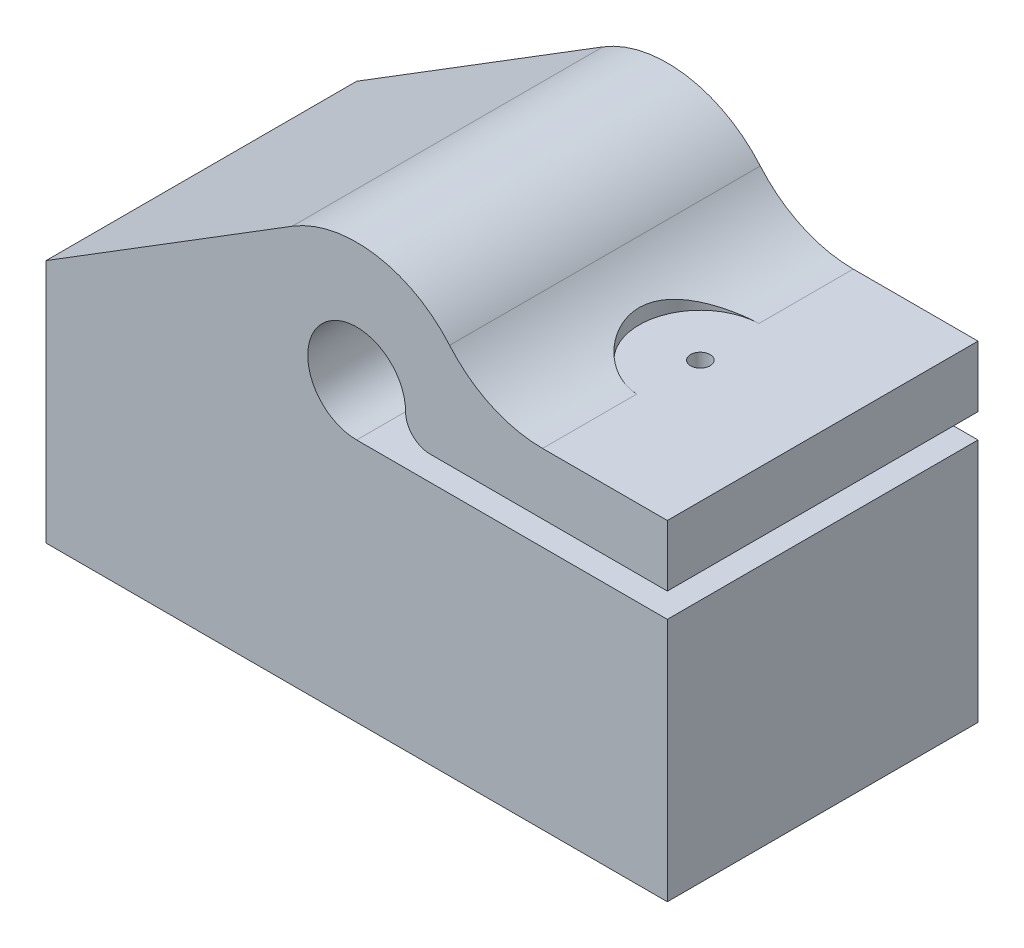
from build123d import *

# Parameters (mm, degrees)
SKETCH1_W                   = 50.8
SKETCH1_H                   = 25.4
BOSS_EXTRUDE1_DEPTH         = 20
BOSS_EXTRUDE2_DEPTH         = 25.4
FILLET1_R                   = 10
FILLET2_R                   = 2
SKETCH3_R                   = 5
CUT_EXTRUDE1_DEPTH          = 40.184818489
TAP_DRILL_FOR_M2X0_4_TAP1_D = 1.6


with BuildPart() as part:
    # Sketch1 → Boss-Extrude1 (new body)
    with BuildSketch(Plane(origin=(0, 0, 0), x_dir=(1, 0, 0), z_dir=(0, 1, 0))):
        Rectangle(SKETCH1_W, SKETCH1_H)
    extrude(amount=BOSS_EXTRUDE1_DEPTH)

    # Sketch2 → Boss-Extrude2 (add, through all)
    with BuildSketch(Plane.XY.offset(12.7)):
        with BuildLine():
            Line((3.464101615, 22), (25.4, 22))
            Line((25.4, 22), (25.4, 27))
            Line((25.4, 27), (9.539392014, 27))
            ThreePointArc((9.539392014, 27), (3.478061726, 33.375664597), (-5.274899627, 32.495612628))
            Line((-5.274899627, 32.495612628), (-25.4, 20))
            Line((-25.4, 20), (-4.8e-08, 20))
            ThreePointArc((-4.8e-08, 20), (-2.828427108, 26.828427142), (4, 24))
            ThreePointArc((4, 24), (3.863703305, 22.96472382), (3.464101615, 22))
        make_face()
    extrude(amount=-BOSS_EXTRUDE2_DEPTH)

    # Fillet1
    fillet1_edges = [part.edges().sort_by_distance(p)[0] for p in [
        (9.539392014, 27, 0),
    ]]
    fillet(fillet1_edges, radius=FILLET1_R)

    # Fillet2
    fillet2_edges = [part.edges().sort_by_distance(p)[0] for p in [
        (3.464101615, 22, 0),
    ]]
    fillet(fillet2_edges, radius=FILLET2_R - 0.0001)  # a hair under: the kernel refuses the full size

    # Sketch3 → Cut-Extrude1 (cut, through all)
    with BuildSketch(Plane(origin=(0, 27, 0), x_dir=(1, 0, 0), z_dir=(0, 1, 0))):
        with Locations((15.4, 0)):
            Circle(SKETCH3_R)
    extrude(amount=CUT_EXTRUDE1_DEPTH, mode=Mode.SUBTRACT)

    # Tap Drill for M2x0.4 Tap1 (through all)
    with Locations(Plane(origin=(0, 27, 0), x_dir=(1, 0, 0), z_dir=(0, 1, 0))):
        with Locations((15.4, 0)):
            Hole(TAP_DRILL_FOR_M2X0_4_TAP1_D / 2)


solid = part.part
